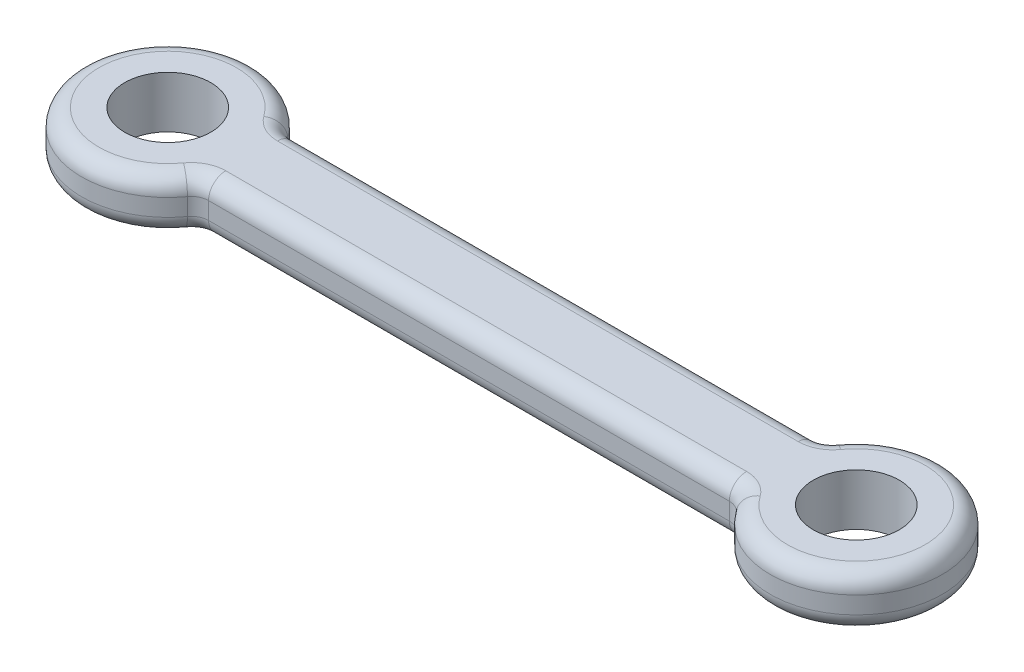
from build123d import *

# Parameters (mm, degrees)
ESBO_O1_R                = 12.5
RESSALTO_EXTRUS_O1_DEPTH = 15
FILETE1_R                = 5


with BuildPart() as part:
    # Esboço1 → Ressalto-extrusão1 (new body)
    with BuildSketch(Plane(origin=(0, 0, 0), x_dir=(1, 0, 0), z_dir=(0, 1, 0))):
        with BuildLine():
            Line((21.650635095, 12.5), (178.349364905, 12.5))
            ThreePointArc((178.349364905, 12.5), (225, 0), (178.349364905, -12.5))
            Line((178.349364905, -12.5), (21.650635095, -12.5))
            ThreePointArc((21.650635095, -12.5), (-25, 0), (21.650635095, 12.5))
        make_face()
        Circle(ESBO_O1_R, mode=Mode.SUBTRACT)
        with Locations((200, 0)):
            Circle(ESBO_O1_R, mode=Mode.SUBTRACT)
    extrude(amount=RESSALTO_EXTRUS_O1_DEPTH)

    # Filete1
    filete1_edges = [part.edges().sort_by_distance(p)[0] for p in [
        (-25, 15, 0),
        (-25, 0, 0),
        (21.650635095, 7.5, 12.5),
        (100, 15, 12.5),
        (100, 0, 12.5),
        (178.349364905, 7.5, 12.5),
        (225, 15, 0),
        (225, 0, 0),
        (178.349364905, 7.5, -12.5),
        (100, 15, -12.5),
        (21.650635095, 7.5, -12.5),
        (100, 0, -12.5),
    ]]
    fillet(filete1_edges, radius=FILETE1_R)


solid = part.part
